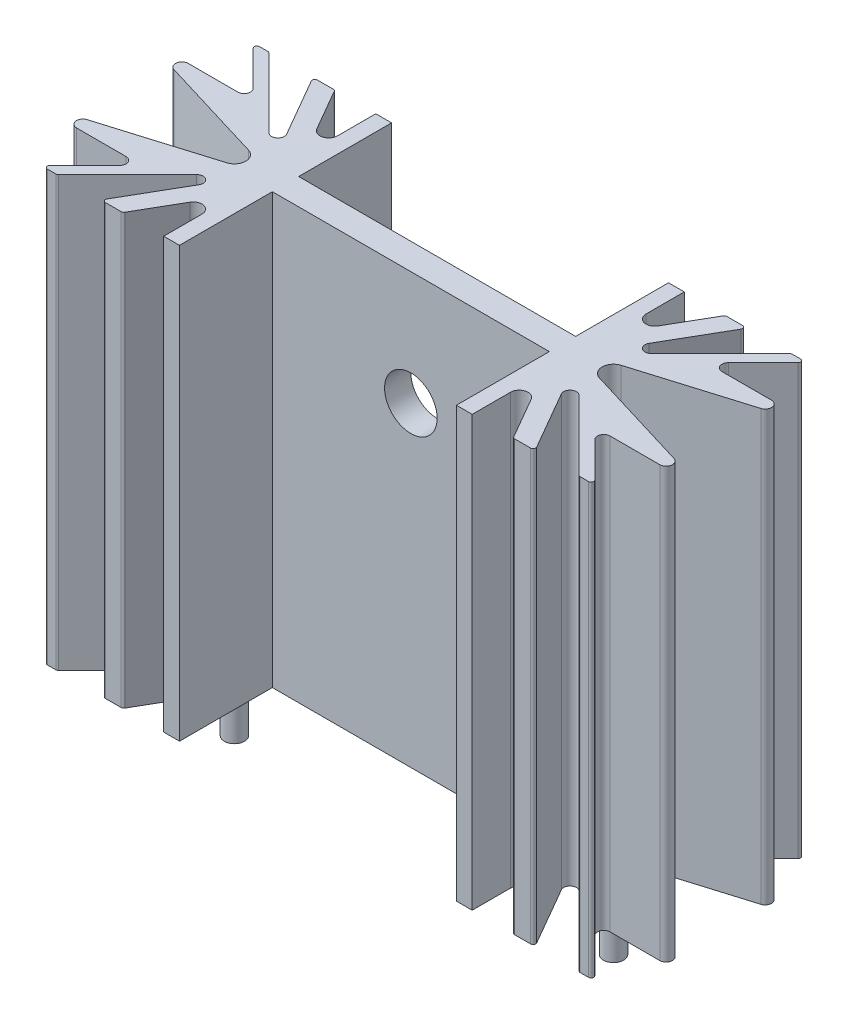
from build123d import *

# Parameters (mm, degrees)
BOSS_EXTRUDE1_DEPTH        = 12.25
SKETCH3_R                  = 1.5
CUT_EXTRUDE1_DEPTH         = 24.5
BOSS_EXTRUDE2_DEPTH        = 4.2
BOSS_EXTRUDE2_DEPTH_BACK   = 6
SKETCH4_R                  = 0.575
BOSS_EXTRUDE2_2_DEPTH      = 4.2
BOSS_EXTRUDE2_2_DEPTH_BACK = 6


with BuildPart() as part:
    # Sketch2 → Boss-Extrude1 (new, symmetric)
    with BuildSketch(Plane(origin=(0, 0, 0), x_dir=(1, 0, 0), z_dir=(0, 1, 0))):
        with BuildLine():
            Line((-7.9, -0.75), (7.9, -0.75))
            Line((7.9, -0.75), (7.9, -6.05))
            Line((7.9, -6.05), (8.8, -6.05))
            Line((8.8, -6.05), (8.8, -3.866025404))
            ThreePointArc((8.8, -3.866025404), (9.170590477, -3.383062491), (9.733012702, -3.616025404))
            Line((9.733012702, -3.616025404), (11.09496732, -5.975))
            ThreePointArc((11.09496732, -5.975), (11.149871131, -6.029903811), (11.224871131, -6.05))
            Line((11.224871131, -6.05), (12.124871131, -6.05))
            ThreePointArc((12.124871131, -6.05), (12.254774941, -5.975), (12.254774941, -5.825))
            Line((12.254774941, -5.825), (10.335085296, -2.5))
            ThreePointArc((10.335085296, -2.5), (10.428503196, -2.030356501), (10.906322312, -2.061674421))
            Line((10.906322312, -2.061674421), (14.850713909, -6.006066017))
            ThreePointArc((14.850713909, -6.006066017), (14.899377411, -6.03858193), (14.956779926, -6.05))
            Line((14.956779926, -6.05), (15.432515857, -6.05))
            ThreePointArc((15.432515857, -6.05), (15.571097787, -5.957402515), (15.538581874, -5.793933983))
            Line((15.538581874, -5.793933983), (13.550912036, -3.806264144))
            ThreePointArc((13.550912036, -3.806264144), (13.472197341, -3.410538651), (13.807677215, -3.186378165))
            Line((13.807677215, -3.186378165), (16.636879201, -3.186378165))
            ThreePointArc((16.636879201, -3.186378165), (16.996077603, -2.876485389), (16.74218532, -2.475741415))
            Line((16.74218532, -2.475741415), (10.624957489, -0.62206673))
            ThreePointArc((10.624957489, -0.62206673), (10.163459435, 0), (10.624957489, 0.62206673))
            Line((10.624957489, 0.62206673), (16.74218532, 2.475741415))
            ThreePointArc((16.74218532, 2.475741415), (16.996077603, 2.876485389), (16.636879201, 3.186378165))
            Line((16.636879201, 3.186378165), (13.807677215, 3.186378165))
            ThreePointArc((13.807677215, 3.186378165), (13.472197341, 3.410538651), (13.550912036, 3.806264144))
            Line((13.550912036, 3.806264144), (15.538581874, 5.793933983))
            ThreePointArc((15.538581874, 5.793933983), (15.571097787, 5.957402515), (15.432515857, 6.05))
            Line((15.432515857, 6.05), (14.956779926, 6.05))
            ThreePointArc((14.956779926, 6.05), (14.899377411, 6.03858193), (14.850713909, 6.006066017))
            Line((14.850713909, 6.006066017), (10.906322312, 2.061674421))
            ThreePointArc((10.906322312, 2.061674421), (10.428503196, 2.030356501), (10.335085296, 2.5))
            Line((10.335085296, 2.5), (12.254774941, 5.825))
            ThreePointArc((12.254774941, 5.825), (12.254774941, 5.975), (12.124871131, 6.05))
            Line((12.124871131, 6.05), (11.224871131, 6.05))
            ThreePointArc((11.224871131, 6.05), (11.149871131, 6.029903811), (11.09496732, 5.975))
            Line((11.09496732, 5.975), (9.733012702, 3.616025404))
            ThreePointArc((9.733012702, 3.616025404), (9.170590477, 3.383062491), (8.8, 3.866025404))
            Line((8.8, 3.866025404), (8.8, 6.05))
            Line((8.8, 6.05), (7.9, 6.05))
            Line((7.9, 6.05), (7.9, 0.75))
            Line((7.9, 0.75), (-7.9, 0.75))
            Line((-7.9, 0.75), (-7.9, 6.05))
            Line((-7.9, 6.05), (-8.8, 6.05))
            Line((-8.8, 6.05), (-8.8, 3.866025404))
            ThreePointArc((-8.8, 3.866025404), (-9.170590477, 3.383062491), (-9.733012702, 3.616025404))
            Line((-9.733012702, 3.616025404), (-11.09496732, 5.975))
            ThreePointArc((-11.09496732, 5.975), (-11.149871131, 6.029903811), (-11.224871131, 6.05))
            Line((-11.224871131, 6.05), (-12.124871131, 6.05))
            ThreePointArc((-12.124871131, 6.05), (-12.254774941, 5.975), (-12.254774941, 5.825))
            Line((-12.254774941, 5.825), (-10.335085296, 2.5))
            ThreePointArc((-10.335085296, 2.5), (-10.428503196, 2.030356501), (-10.906322312, 2.061674421))
            Line((-10.906322312, 2.061674421), (-14.850713909, 6.006066017))
            ThreePointArc((-14.850713909, 6.006066017), (-14.899377411, 6.03858193), (-14.956779926, 6.05))
            Line((-14.956779926, 6.05), (-15.432515857, 6.05))
            ThreePointArc((-15.432515857, 6.05), (-15.571097787, 5.957402515), (-15.538581874, 5.793933983))
            Line((-15.538581874, 5.793933983), (-13.550912036, 3.806264144))
            ThreePointArc((-13.550912036, 3.806264144), (-13.472197341, 3.410538651), (-13.807677215, 3.186378165))
            Line((-13.807677215, 3.186378165), (-16.636879201, 3.186378165))
            ThreePointArc((-16.636879201, 3.186378165), (-16.996077603, 2.876485389), (-16.74218532, 2.475741415))
            Line((-16.74218532, 2.475741415), (-10.624957489, 0.62206673))
            ThreePointArc((-10.624957489, 0.62206673), (-10.163459435, 0), (-10.624957489, -0.62206673))
            Line((-10.624957489, -0.62206673), (-16.74218532, -2.475741415))
            ThreePointArc((-16.74218532, -2.475741415), (-16.996077603, -2.876485389), (-16.636879201, -3.186378165))
            Line((-16.636879201, -3.186378165), (-13.807677215, -3.186378165))
            ThreePointArc((-13.807677215, -3.186378165), (-13.472197341, -3.410538651), (-13.550912036, -3.806264144))
            Line((-13.550912036, -3.806264144), (-15.538581874, -5.793933983))
            ThreePointArc((-15.538581874, -5.793933983), (-15.571097787, -5.957402515), (-15.432515857, -6.05))
            Line((-15.432515857, -6.05), (-14.956779926, -6.05))
            ThreePointArc((-14.956779926, -6.05), (-14.899377411, -6.03858193), (-14.850713909, -6.006066017))
            Line((-14.850713909, -6.006066017), (-10.906322312, -2.061674421))
            ThreePointArc((-10.906322312, -2.061674421), (-10.428503196, -2.030356501), (-10.335085296, -2.5))
            Line((-10.335085296, -2.5), (-12.254774941, -5.825))
            ThreePointArc((-12.254774941, -5.825), (-12.254774941, -5.975), (-12.124871131, -6.05))
            Line((-12.124871131, -6.05), (-11.224871131, -6.05))
            ThreePointArc((-11.224871131, -6.05), (-11.149871131, -6.029903811), (-11.09496732, -5.975))
            Line((-11.09496732, -5.975), (-9.733012702, -3.616025404))
            ThreePointArc((-9.733012702, -3.616025404), (-9.170590477, -3.383062491), (-8.8, -3.866025404))
            Line((-8.8, -3.866025404), (-8.8, -6.05))
            Line((-8.8, -6.05), (-7.9, -6.05))
            Line((-7.9, -6.05), (-7.9, -0.75))
        make_face()
    extrude(amount=BOSS_EXTRUDE1_DEPTH, both=True)

    # Sketch3 → Cut-Extrude1 (cut)
    with BuildSketch(Plane.XY.offset(0.75)):
        with Locations((0, 5.75)):
            Circle(SKETCH3_R)
    extrude(amount=-CUT_EXTRUDE1_DEPTH, mode=Mode.SUBTRACT)


with BuildPart() as body_2:
    # Sketch4 → Boss-Extrude2 (new, two sides: drawn at the far end of the back side and taken through both)
    with BuildSketch(Plane.XZ.offset(12.25).offset(-BOSS_EXTRUDE2_DEPTH_BACK)):
        with Locations((-10.813459435, 0)):
            Circle(SKETCH4_R)
    extrude(amount=BOSS_EXTRUDE2_DEPTH + BOSS_EXTRUDE2_DEPTH_BACK)


with BuildPart() as body_3:
    # Sketch4 → Boss-Extrude2 2 (new, two sides: drawn at the far end of the back side and taken through both)
    with BuildSketch(Plane.XZ.offset(12.25).offset(-BOSS_EXTRUDE2_2_DEPTH_BACK)):
        with Locations((10.813459435, 0)):
            Circle(SKETCH4_R)
    extrude(amount=BOSS_EXTRUDE2_2_DEPTH + BOSS_EXTRUDE2_2_DEPTH_BACK)


solid = Compound([part.part, body_2.part, body_3.part])
